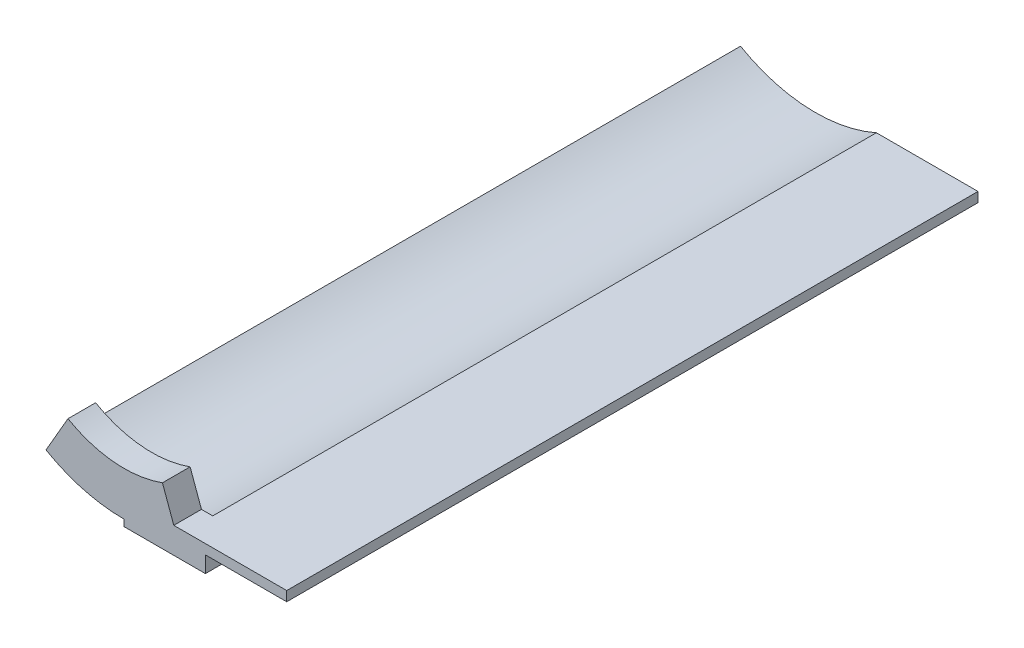
from build123d import *

# Parameters (mm, degrees)
EXTRUDE_1_DEPTH = 8.5
EXTRUDE_START   = -204
EXTRUDE_5_DEPTH = 204


with BuildPart() as part:
    # 草图1 → 凸台-拉伸1 (new body)
    with BuildSketch(Plane.XY):
        with BuildLine():
            Line((0, -50), (25, -50))
            Line((25, -50), (25, -45))
            Line((25, -45), (50, -45))
            Line((50, -45), (50, -42))
            Line((50, -42), (15.286749839, -42))
            Line((15.286749839, -42), (11.799694945, -32.419395417))
            ThreePointArc((11.799694945, -32.419395417), (5.99086213, -33.975867479), (0, -34.5))
            ThreePointArc((0, -34.5), (-8.929257056, -33.324441007), (-17.25, -29.877876431))
            Line((-17.25, -29.877876431), (-24, -41.569219382))
            ThreePointArc((-24, -41.569219382), (-12.423314165, -46.364439662), (0, -48))
            Line((0, -48), (0, -50))
        make_face()
    extrude(amount=EXTRUDE_1_DEPTH)

    # 草图3 → 凸台-拉伸5 (add)
    with BuildSketch(Plane.XY.offset(EXTRUDE_START)):
        with BuildLine():
            Line((50, -42), (23, -42))
            Line((23, -42), (18.761663039, -42))
            ThreePointArc((18.761663039, -42), (9.591663047, -44.988887517), (0, -46))
            ThreePointArc((0, -46), (-11.905676075, -44.432588009), (-23, -39.837168574))
            Line((-23, -39.837168574), (-24, -41.569219382))
            ThreePointArc((-24, -41.569219382), (-12.423314165, -46.364439662), (0, -48))
            Line((0, -48), (0, -50))
            Line((0, -50), (25, -50))
            Line((25, -50), (25, -45))
            Line((25, -45), (50, -45))
            Line((50, -45), (50, -42))
        make_face()
    extrude(amount=EXTRUDE_5_DEPTH)


solid = part.part
